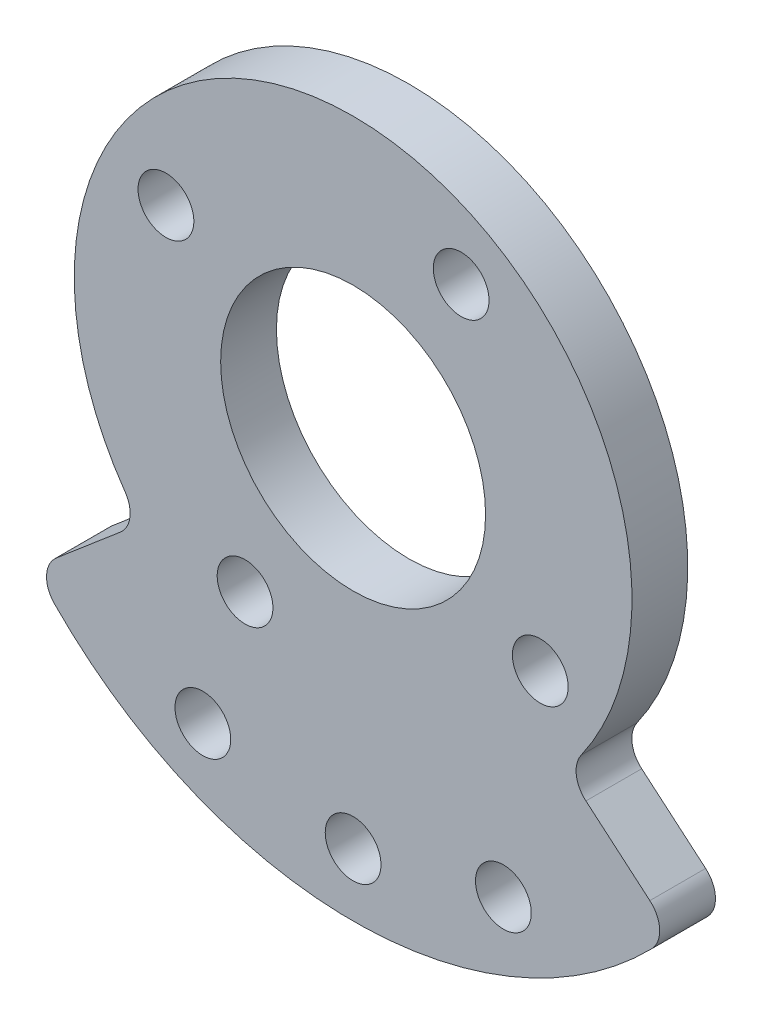
from build123d import *

# Parameters (mm, degrees)
SKETCH_1_R           = 20
SKETCH_1_R_2         = 2
EXTRUDE_1_DEPTH      = 4
EXTRUDE_START        = -4
EXTRUDE_2_DEPTH      = 4
FILLET_2_R           = 5
FILLET_3_R           = 5
SKETCH_3_R           = 58.160089131
SKETCH_3_R_2         = 39.60449563
CUT_EXTRUDE_1_DEPTH  = 4
FILLET_4_R           = 8
EXTRUDE_3_DEPTH      = 4
SKETCH_5_R           = 2
CUT_EXTRUDE_2_DEPTH  = 4
SKETCH_6_R           = 2
CUT_EXTRUDE_3_DEPTH  = 10
EXTRUDE_4_DEPTH      = 4
EXTRUDE_6_DEPTH      = 4
CUT_EXTRUDE_6_DEPTH  = 4
FILLET_6_R           = 10
FILLET_7_R           = 10
FILLET_8_R           = 10
SKETCH_10_R          = 2
EXTRUDE_7_DEPTH      = 4
SKETCH_11_R          = 55.332509923
SKETCH_11_R_2        = 30
CUT_EXTRUDE_7_DEPTH  = 4
EXTRUDE_8_DEPTH      = 4
SKETCH_13_R          = 2
CUT_EXTRUDE_8_DEPTH  = 4
SKETCH_14_R          = 9.5
CUT_EXTRUDE_9_DEPTH  = 10
SKETCH_15_R          = 2
EXTRUDE_9_DEPTH      = 5
SKETCH_16_R          = 20
SKETCH_16_R_2        = 9.5
EXTRUDE_10_DEPTH     = 4
SKETCH_18_R          = 2
CUT_EXTRUDE_11_DEPTH = 39.776527497
FILLET_9_R           = 2
FILLET_10_R          = 2
CUT_EXTRUDE_START    = -5
SKETCH_19_R          = 2
CUT_EXTRUDE_12_DEPTH = 5


with BuildPart() as part:
    # 草图1 → 凸台-拉伸1 (new body)
    with BuildSketch(Plane.XY):
        Circle(SKETCH_1_R)
        with Locations((-15.5, 0)):
            Circle(SKETCH_1_R_2, mode=Mode.SUBTRACT)
        with Locations((15.5, 0)):
            Circle(SKETCH_1_R_2, mode=Mode.SUBTRACT)
        with Locations((-7.75, 13.423393759)):
            Circle(SKETCH_1_R_2, mode=Mode.SUBTRACT)
        with Locations((-7.75, -13.423393759)):
            Circle(SKETCH_1_R_2, mode=Mode.SUBTRACT)
        with Locations((7.75, -13.423393759)):
            Circle(SKETCH_1_R_2, mode=Mode.SUBTRACT)
        with Locations((7.75, 13.423393759)):
            Circle(SKETCH_1_R_2, mode=Mode.SUBTRACT)
    extrude(amount=EXTRUDE_1_DEPTH)

    # 草图2 → 凸台-拉伸2 (add)
    with BuildSketch(Plane.XY.offset(4).offset(EXTRUDE_START)):
        with BuildLine():
            add(Edge.make_bspline(
                [(-31.652235688, -31.652235688), (-33.388516019, -22.659494294), (-23.392443281, -20.962737075), (-16.1166561, -16.161254448), (-15.240575556, -12.950863166)],
                knots=[0, 0, 0, 0, 0.575012139, 0.86884139, 0.86884139, 0.86884139, 0.86884139], degree=3))
            ThreePointArc((-31.652235688, -31.652235688), (0, -44.76302099), (31.652235688, -31.652235688))
            add(Edge.make_bspline(
                [(31.652235688, -31.652235688), (33.388516019, -22.659494294), (23.392443281, -20.962737075), (16.1166561, -16.161254448), (15.240575556, -12.950863166)],
                knots=[0, 0, 0, 0, 0.575012139, 0.86884139, 0.86884139, 0.86884139, 0.86884139], degree=3))
            ThreePointArc((15.240575556, -12.950863166), (0, -20), (-15.240575556, -12.950863166))
        make_face()
    extrude(amount=EXTRUDE_2_DEPTH)

    # 圆角2
    fillet_2_edges = [part.edges().sort_by_distance(p)[0] for p in [
        (-31.652235688, -31.652235688, 2),
    ]]
    fillet(fillet_2_edges, radius=FILLET_2_R)

    # 圆角3
    fillet_3_edges = [part.edges().sort_by_distance(p)[0] for p in [
        (31.652235688, -31.652235688, 2),
    ]]
    fillet(fillet_3_edges, radius=FILLET_3_R)

    # 草图3 → 切除-拉伸1 (cut)
    with BuildSketch(Plane(origin=(0, 0, 0), x_dir=(-1, 0, 0), z_dir=(0, 0, -1))):
        Circle(SKETCH_3_R)
        Circle(SKETCH_3_R_2, mode=Mode.SUBTRACT)
    extrude(amount=-CUT_EXTRUDE_1_DEPTH, mode=Mode.SUBTRACT)

    # 圆角4
    fillet_4_edges = [part.edges().sort_by_distance(p)[0] for p in [
        (30.87581987, -24.803221997, 2),
        (-30.87581987, -24.803221997, 2),
    ]]
    fillet(fillet_4_edges, radius=FILLET_4_R)

    # 草图4 → 凸台-拉伸3 (add)
    with BuildSketch(Plane(origin=(0, 0, 0), x_dir=(-1, 0, 0), z_dir=(0, 0, -1))):
        with BuildLine():
            Line((-22.183787779, -32.808468935), (-22.405322857, -33.136105801))
            ThreePointArc((-22.405322857, -33.136105801), (0.038199329, -39.99998176), (22.468570811, -33.093251967))
            Line((22.468570811, -33.093251967), (22.183787779, -32.808468935))
            ThreePointArc((22.183787779, -32.808468935), (0, -39.60449563), (-22.183787779, -32.808468935))
        make_face()
    extrude(amount=-EXTRUDE_3_DEPTH)

    # 草图5 → 切除-拉伸2 (cut)
    with BuildSketch(Plane(origin=(0, 0, 0), x_dir=(-1, 0, 0), z_dir=(0, 0, -1))):
        with Locations((-15.848184815, -33.986542014)):
            Circle(SKETCH_5_R)
        with Locations((0, -37.5)):
            Circle(SKETCH_5_R)
        with Locations(Location((15.848184815, -33.986542014, 0), (0, 0, 180))):
            Circle(SKETCH_5_R)
    extrude(amount=-CUT_EXTRUDE_2_DEPTH, mode=Mode.SUBTRACT)

    # 草图6 → 切除-拉伸3 (cut)
    with BuildSketch(Plane(origin=(0, 0, 0), x_dir=(-1, 0, 0), z_dir=(0, 0, -1))):
        with Locations((0.038199329, -29.99998176)):
            Circle(SKETCH_6_R)
    extrude(amount=-CUT_EXTRUDE_3_DEPTH, mode=Mode.SUBTRACT)

    # 草图7 → 凸台-拉伸4 (add)
    with BuildSketch(Plane.XY.offset(4)):
        with BuildLine():
            Line((-22.468570811, -33.093251967), (-23.907156981, -34.531838137))
            ThreePointArc((-23.907156981, -34.531838137), (-0.231167262, -41.999363825), (23.525589, -34.792911091))
            Line((23.525589, -34.792911091), (22.405322857, -33.136105801))
            Line((22.405322857, -33.136105801), (22.183787779, -32.808468935))
            ThreePointArc((22.183787779, -32.808468935), (0, -39.60449563), (-22.183787779, -32.808468935))
            Line((-22.183787779, -32.808468935), (-22.468570811, -33.093251967))
        make_face()
    extrude(amount=-EXTRUDE_4_DEPTH)

    # 草图8 → 凸台-拉伸6 (add)
    with BuildSketch(Plane(origin=(0, 0, 0), x_dir=(-1, 0, 0), z_dir=(0, 0, -1))):
        with BuildLine():
            Line((-25.678439695, -25.558394246), (-20.516854663, -32.863070329))
            Line((-20.516854663, -32.863070329), (-23.525589, -34.792911091))
            add(Edge.make_bspline(
                [(-23.525589, -34.792911091), (-26.001835591, -30.056258517), (-25.678439695, -25.558394246)],
                knots=[0, 0, 0, 0.47951431, 0.47951431, 0.47951431], degree=2))
        make_face()
        with BuildLine():
            Line((20.516854663, -32.863070329), (23.525589, -34.792911091))
            add(Edge.make_bspline(
                [(23.525589, -34.792911091), (26.001835591, -30.056258517), (25.678439695, -25.558394246)],
                knots=[0, 0, 0, 0.47951431, 0.47951431, 0.47951431], degree=2))
            Line((25.678439695, -25.558394246), (20.516854663, -32.863070329))
        make_face()
    extrude(amount=-EXTRUDE_6_DEPTH)

    # 草图9 → 切除-拉伸6 (cut)
    with BuildSketch(Plane(origin=(0, 0, 0), x_dir=(-1, 0, 0), z_dir=(0, 0, -1))):
        Polygon((23.742659966, -34.367341122), (22.906265437, -35.20373565), (24.433492861, -34.374984505), align=None)
    extrude(amount=-CUT_EXTRUDE_6_DEPTH, mode=Mode.SUBTRACT)

    # 圆角6
    fillet_6_edges = [part.edges().sort_by_distance(p)[0] for p in [
        (23.525589, -34.792911091, 2),
    ]]
    fillet(fillet_6_edges, radius=FILLET_6_R)

    # 圆角7
    # the kernel refuses this fillet: 10 mm, written as the material it takes off along each edge
    with BuildSketch(Plane(origin=(-23.742659966, -34.367341122, 10.292446297), x_dir=(0.7071067812003878, -0.7071067811727072, 0), z_dir=(0, 0, -1))) as fillet_7_piece_1:
        with BuildLine():
            CenterArc((1.956172782, -9.970053017), FILLET_7_R, 94.435296014, 20.980736708)
            Line((-2.335706132, -0.937900705), (-2.42154371, -0.757257658))
            ThreePointArc((-2.42154371, -0.757257658), (-1.256201499, -0.248323162), (-0.06365122, 0.189600955))
            Line((-0.06365122, 0.189600955), (0, 0.2))
            ThreePointArc((0, 0.2), (0.591420243, 0.2), (1.16737384, 0.19940106))
            Line((1.16737384, 0.19940106), (1.182840486, 0))
        make_face()
    extrude(amount=16.584892581, mode=Mode.SUBTRACT)

    # 圆角8
    fillet_8_edges = [part.edges().sort_by_distance(p)[0] for p in [
        (-22.906265437, -35.20373565, 2),
    ]]
    fillet(fillet_8_edges, radius=FILLET_8_R)

    # 草图10 → 凸台-拉伸7 (add)
    with BuildSketch(Plane(origin=(0, 0, 0), x_dir=(-1, 0, 0), z_dir=(0, 0, -1))):
        with Locations((0.038199329, -29.99998176)):
            Circle(SKETCH_10_R)
        with Locations((0, -37.5)):
            Circle(SKETCH_10_R)
        with Locations((15.848184815, -33.986542014)):
            Circle(SKETCH_10_R)
        with Locations((-15.848184815, -33.986542014)):
            Circle(SKETCH_10_R)
    extrude(amount=-EXTRUDE_7_DEPTH)

    # 草图11 → 切除-拉伸7 (cut)
    with BuildSketch(Plane(origin=(0, 0, 0), x_dir=(-1, 0, 0), z_dir=(0, 0, -1))):
        Circle(SKETCH_11_R)
        Circle(SKETCH_11_R_2, mode=Mode.SUBTRACT)
    extrude(amount=-CUT_EXTRUDE_7_DEPTH, mode=Mode.SUBTRACT)

    # 草图12 → 凸台-拉伸8 (add)
    with BuildSketch(Plane(origin=(0, 0, 0), x_dir=(-1, 0, 0), z_dir=(0, 0, -1))):
        with BuildLine():
            Line((-15.240575556, -12.950863166), (-22.860863333, -19.426294749))
            ThreePointArc((-22.860863333, -19.426294749), (-19.109156974, -23.126610641), (-14.767877105, -26.1134028))
            Line((-14.767877105, -26.1134028), (-15.240575556, -12.950863166))
        make_face()
        with BuildLine():
            Line((15.240575556, -12.950863166), (14.767877105, -26.1134028))
            ThreePointArc((14.767877105, -26.1134028), (19.109156974, -23.126610641), (22.860863333, -19.426294749))
            Line((22.860863333, -19.426294749), (15.240575556, -12.950863166))
        make_face()
    extrude(amount=-EXTRUDE_8_DEPTH)

    # 草图13 → 切除-拉伸8 (cut)
    with BuildSketch(Plane(origin=(0, 0, 0), x_dir=(-1, 0, 0), z_dir=(0, 0, -1))):
        with Locations((-10.776765674, -23.110848569)):
            Circle(SKETCH_13_R)
        with Locations((0, -25.5)):
            Circle(SKETCH_13_R)
        with Locations(Location((10.776765674, -23.110848569, 0), (0, 0, 180))):
            Circle(SKETCH_13_R)
    extrude(amount=-CUT_EXTRUDE_8_DEPTH, mode=Mode.SUBTRACT)

    # 草图14 → 切除-拉伸9 (cut)
    with BuildSketch(Plane(origin=(0, 0, 0), x_dir=(-1, 0, 0), z_dir=(0, 0, -1))):
        Circle(SKETCH_14_R)
    extrude(amount=-CUT_EXTRUDE_9_DEPTH, mode=Mode.SUBTRACT)

    # 草图15 → 凸台-拉伸9 (add)
    with BuildSketch(Plane(origin=(0, 0, 0), x_dir=(-1, 0, 0), z_dir=(0, 0, -1))):
        with Locations(Location((0, 15.5, 0), (0, 0, 180))):
            Circle(SKETCH_15_R)
        with Locations(Location((0, -15.5, 0), (0, 0, 180))):
            Circle(SKETCH_15_R)
        with Locations(Location((-13.423393758, 7.75, 0), (0, 0, 180))):
            Circle(SKETCH_15_R)
        with Locations(Location((13.423393759, 7.75, 0), (0, 0, 180))):
            Circle(SKETCH_15_R)
        with Locations(Location((13.423393759, -7.75, 0), (0, 0, 180))):
            Circle(SKETCH_15_R)
        with Locations(Location((-13.423393758, -7.75, 0), (0, 0, 180))):
            Circle(SKETCH_15_R)
    extrude(amount=EXTRUDE_9_DEPTH)

    # 草图16 → 凸台-拉伸10 (add)
    with BuildSketch(Plane.XY.offset(4).offset(EXTRUDE_START)):
        Circle(SKETCH_16_R)
        with Locations(Location((0, 0, 0), (0, 0, 180))):
            Circle(SKETCH_16_R_2, mode=Mode.SUBTRACT)
    extrude(amount=EXTRUDE_10_DEPTH)

    # 草图18 → 切除-拉伸11 (cut, through all)
    with BuildSketch(Plane(origin=(0, 0, -5), x_dir=(-1, 0, 0), z_dir=(0, 0, -1))):
        with Locations((13.423393759, 7.75)):
            Circle(SKETCH_18_R)
        with Locations((7.75, -13.423393759)):
            Circle(SKETCH_18_R)
        with Locations((-13.423393759, -7.75)):
            Circle(SKETCH_18_R)
        with Locations((-7.75, 13.423393759)):
            Circle(SKETCH_18_R)
    extrude(amount=-CUT_EXTRUDE_11_DEPTH, mode=Mode.SUBTRACT)

    # 圆角9
    fillet_9_edges = [part.edges().sort_by_distance(p)[0] for p in [
        (-15.240575556, -12.950863166, 2),
        (15.240575556, -12.950863166, 2),
    ]]
    fillet(fillet_9_edges, radius=FILLET_9_R)

    # 圆角10
    fillet_10_edges = [part.edges().sort_by_distance(p)[0] for p in [
        (22.860863333, -19.426294749, 2),
        (-22.860863333, -19.426294749, 2),
    ]]
    fillet(fillet_10_edges, radius=FILLET_10_R)

    # 草图19 → 切除-拉伸12 (cut)
    with BuildSketch(Plane(origin=(0, 0, -5), x_dir=(-1, 0, 0), z_dir=(0, 0, -1)).offset(CUT_EXTRUDE_START)):
        with Locations((0, 15.5)):
            Circle(SKETCH_19_R)
        with Locations((0, -15.5)):
            Circle(SKETCH_19_R)
        with Locations((13.423393759, -7.75)):
            Circle(SKETCH_19_R)
        with Locations((-13.423393758, 7.75)):
            Circle(SKETCH_19_R)
    extrude(amount=CUT_EXTRUDE_12_DEPTH, mode=Mode.SUBTRACT)


solid = part.part
